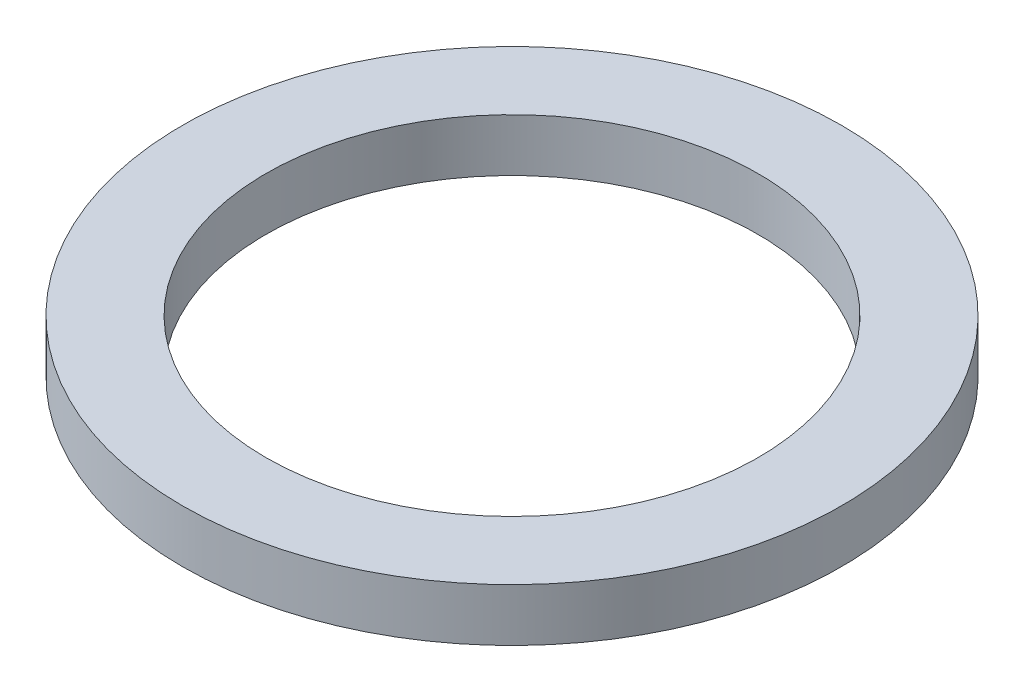
from build123d import *

# Parameters (mm, degrees)
SKETCH1_R           = 19.05
BOSS_EXTRUDE1_DEPTH = 3.048
SKETCH2_R           = 14.224
CUT_EXTRUDE1_DEPTH  = 28.112641037


with BuildPart() as part:
    # Sketch1 → Boss-Extrude1 (new body)
    with BuildSketch(Plane(origin=(0, 0, 0), x_dir=(1, 0, 0), z_dir=(0, 1, 0))):
        with Locations(Location((0, 0, 0), (0, 0, 90))):
            Circle(SKETCH1_R)
    extrude(amount=BOSS_EXTRUDE1_DEPTH)

    # Sketch2 → Cut-Extrude1 (cut, through all)
    with BuildSketch(Plane(origin=(0, 3.048, 0), x_dir=(1, 0, 0), z_dir=(0, 1, 0))):
        with Locations(Location((0, 0, 0), (0, 0, 270))):
            Circle(SKETCH2_R)
    extrude(amount=-CUT_EXTRUDE1_DEPTH, mode=Mode.SUBTRACT)


solid = part.part
